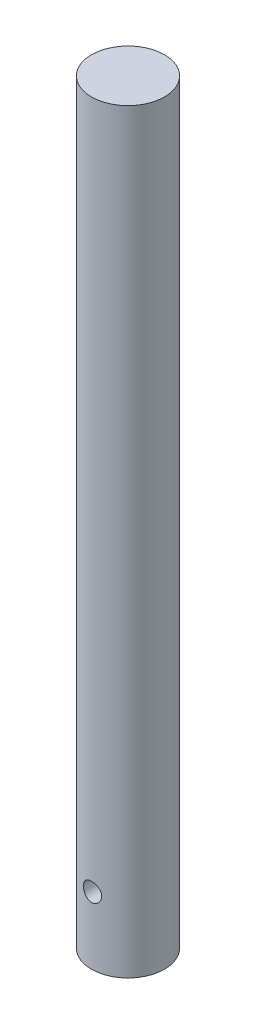
from build123d import *

# Parameters (mm, degrees)
CROQUIS4_R                 = 19.05
SALIENTE_EXTRUIR2_DEPTH    = 394
CORTAR_EXTRUIR2_DEPTH      = 395.919998227
CORTAR_EXTRUIR2_DEPTH_BACK = 395.919998227
CROQUIS5_R                 = 4.765


with BuildPart() as part:
    # Croquis4 → Saliente-Extruir2 (new body)
    with BuildSketch(Plane(origin=(0, 0, 0), x_dir=(1, 0, 0), z_dir=(0, 1, 0))):
        Circle(CROQUIS4_R)
    extrude(amount=SALIENTE_EXTRUIR2_DEPTH)

    # Croquis5 → Cortar-Extruir2 (cut, two sides: drawn at the far end of the back side and taken through both)
    with BuildSketch(Plane.XY.offset(-CORTAR_EXTRUIR2_DEPTH_BACK)):
        with Locations((0, 35)):
            Circle(CROQUIS5_R)
    extrude(amount=CORTAR_EXTRUIR2_DEPTH + CORTAR_EXTRUIR2_DEPTH_BACK, mode=Mode.SUBTRACT)


solid = part.part
